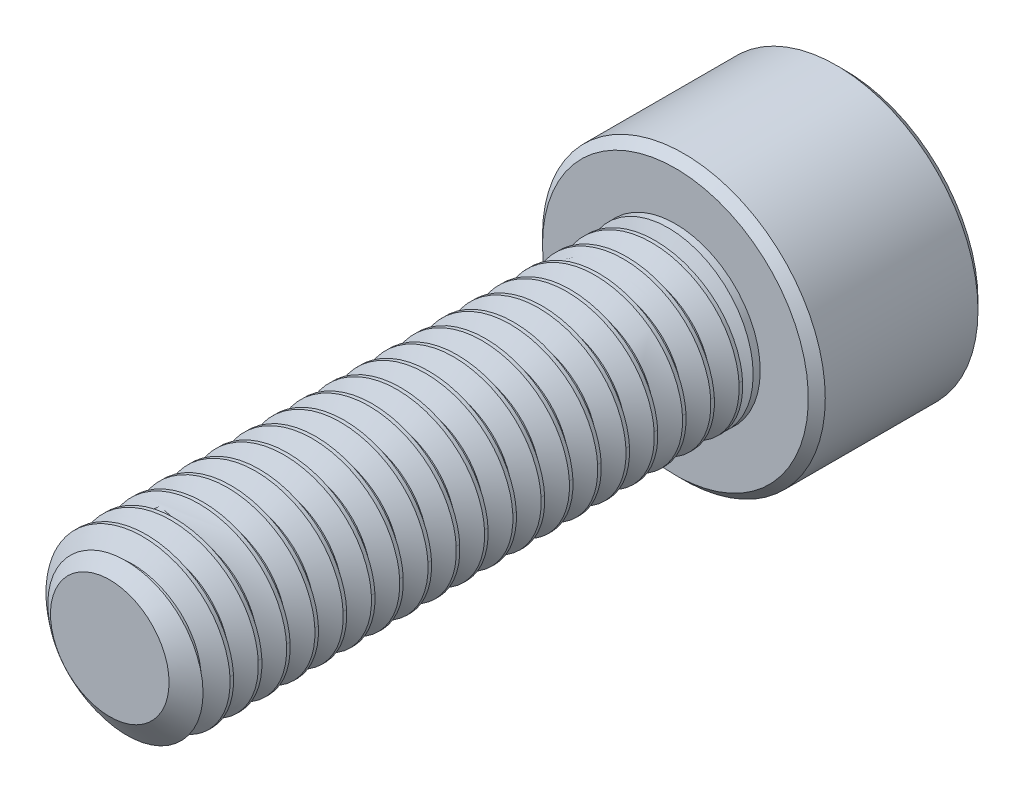
from build123d import *

# Parameters (mm, degrees)
SKETCH1_R          = 3
EXTRUDE1_DEPTH     = 20
CUT_SWEEP1_PITCH   = 1
SKETCH6_R          = 5
EXTRUDE2_DEPTH     = 6
CUT_EXTRUDE1_DEPTH = 3.75
CHAMFER1_SIZE      = 0.3


with BuildPart() as part:
    # Sketch1 → Extrude1 (new body)
    with BuildSketch(Plane.XY):
        Circle(SKETCH1_R)
    extrude(amount=-EXTRUDE1_DEPTH)

    # Cut-Sweep1: the profile of Sketch3 profile screwed along a right-hand helix of 21 turns, 6 arcs to a turn; built about Z, then put on its axis
    cut_sweep1_z = Axis((0, 0, 0), (0, 0, 1))
    cut_sweep1_corners = [(3.0003, 0, -0.875173205), (2.350480947, 0, -0.5), (2.350480947, 0, -0.375), (3.0003, 0, 0.000173205)]
    with BuildLine(mode=Mode.PRIVATE) as cut_sweep1_profile:
        Line(cut_sweep1_corners[0], cut_sweep1_corners[1])
        Line(cut_sweep1_corners[1], cut_sweep1_corners[2])
        Line(cut_sweep1_corners[2], cut_sweep1_corners[3])
        Line(cut_sweep1_corners[3], cut_sweep1_corners[0])
    cut_sweep1_cap = Face(cut_sweep1_profile.wire())
    cut_sweep1_turn_angles = [0, 30, 60, 90, 120, 150, 180, 210, 240, 270, 300, 330, 360]
    cut_sweep1_turn_weights = [1, 0.8660254037844387, 1, 0.8660254037844387, 1, 0.8660254037844387, 1, 0.8660254037844387, 1, 0.8660254037844387, 1, 0.8660254037844387, 1]
    cut_sweep1_turn_rails = [Edge.make_bspline([Vector(p[0], p[1], 0).rotate(cut_sweep1_z, cut_sweep1_turn_angles[k]) / cut_sweep1_turn_weights[k] + Vector(0, 0, p[2] + CUT_SWEEP1_PITCH * cut_sweep1_turn_angles[k] / 360) for k in range(13)], [0, 0, 0, 1, 1, 2, 2, 3, 3, 4, 4, 5, 5, 6, 6, 6], 2, cut_sweep1_turn_weights) for p in cut_sweep1_corners]
    cut_sweep1_turn_sides = [Face.make_surface_from_curves(cut_sweep1_turn_rails[p[0]], cut_sweep1_turn_rails[p[1]]) for p in [(0, 1), (1, 2), (2, 3), (3, 0)]]
    cut_sweep1 = Plane(origin=(0, 0, 0), x_dir=(0, 1, 0), z_dir=(0, 0, -1)) * Solid(Shell([*[p.moved(Location((0, 0, CUT_SWEEP1_PITCH * i))) for i in range(21) for p in cut_sweep1_turn_sides], cut_sweep1_cap, cut_sweep1_cap.rotate(cut_sweep1_z, 7560).moved(Location((0, 0, CUT_SWEEP1_PITCH * 7560 / 360)))]))
    add(cut_sweep1, mode=Mode.SUBTRACT)

    # Sketch4 → Cut-Revolve1 (revolve, cut)
    with BuildSketch(Plane(origin=(0, 0, 0), x_dir=(0, 0, -1), z_dir=(1, 0, 0)), mode=Mode.PRIVATE) as cut_revolve1_sk:
        Polygon((0.632650852, 3), (0, 2.096480947), (0, 3), align=None)
    revolve(cut_revolve1_sk.sketch.rotate(Axis((0, 0, 0), (0, 0, -1)), 90), axis=Axis((0, 0, 0), (0, 0, -1)), mode=Mode.SUBTRACT)

    # Sketch6 → Extrude2 (add)
    with BuildSketch(Plane(origin=(0, 0, -20), x_dir=(-1, 0, 0), z_dir=(0, 0, -1))):
        with Locations(Location((0, 0, 0), (0, 0, 180))):
            Circle(SKETCH6_R)
    extrude(amount=EXTRUDE2_DEPTH)

    # Sketch7 → Cut-Extrude1 (cut)
    with BuildSketch(Plane(origin=(0, 0, -26), x_dir=(-1, 0, 0), z_dir=(0, 0, -1))):
        Polygon((0, 2.886751346), (-2.5, 1.443375673), (-2.5, -1.443375673), (0, -2.886751346), (2.5, -1.443375673), (2.5, 1.443375673), align=None)
    extrude(amount=-CUT_EXTRUDE1_DEPTH, mode=Mode.SUBTRACT)

    # Cut-Extrude2 cone 1 section (through the dimple's axis) → Cut-Extrude2 (revolve, cut)
    with BuildSketch(Plane(origin=(0, 0, -26), x_dir=(0, 1, 0), z_dir=(1, 0, 0))):
        Polygon((0, 0), (2.886751346, 0), (0, 2.886751346), align=None)
    revolve(axis=Axis((0, 0, -26), (0, 0, 1)), mode=Mode.SUBTRACT)

    # Chamfer1
    chamfer1_edges = [part.edges().sort_by_distance(p)[0] for p in [
        (-5, 0, -20),
        (-5, 0, -26),
    ]]
    chamfer(chamfer1_edges, length=CHAMFER1_SIZE)

    # Sketch10 → Revolve1 (revolve)
    with BuildSketch(Plane(origin=(0, 0, 0), x_dir=(0, 0, -1), z_dir=(1, 0, 0)), mode=Mode.PRIVATE) as revolve1_sk:
        Polygon((20, 3), (20, 0), (18.507359313, 0), (19.75, 3), align=None)
    revolve(revolve1_sk.sketch.rotate(Axis((0, 0, -20), (0, 0, 1)), 270), axis=Axis((0, 0, -20), (0, 0, 1)))


solid = part.part
